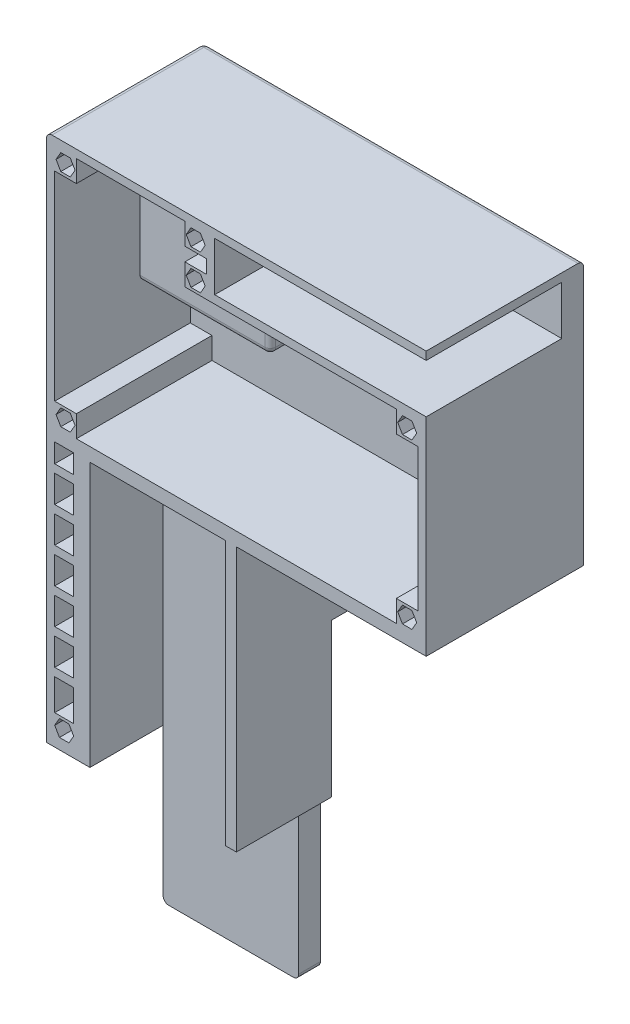
from build123d import *

# Parameters (mm, degrees)
EXTRUDE_1_DEPTH        = 8
SKETCH_7_W             = 53
SKETCH_7_H             = 154
EXTRUDE_4_DEPTH        = 8
SKETCH_8_W             = 3
SKETCH_8_H             = 56.5
CUT_EXTRUDE_7_DEPTH    = 184.508458055
SKETCH_11_W            = 75
SKETCH_11_H            = 3
EXTRUDE_7_DEPTH        = 50
SKETCH_13_W            = 3
SKETCH_13_H            = 94.5
EXTRUDE_8_DEPTH        = 40
SKETCH_14_W            = 3
SKETCH_14_H            = 97.5
EXTRUDE_13_DEPTH       = 17
EXTRUDE_14_DEPTH       = 50
SKETCH_18_W            = 6
SKETCH_18_H            = 94.5
EXTRUDE_15_DEPTH       = 35
SKETCH_3_W             = 57
SKETCH_3_H             = 23
CUT_EXTRUDE_10_DEPTH   = 56.5
SKETCH_19_W            = 8
SKETCH_19_H            = 8
EXTRUDE_19_DEPTH       = 43
SKETCH_25_W            = 10
SKETCH_25_H            = 3
EXTRUDE_20_DEPTH       = 15
SKETCH_26_W            = 8
SKETCH_26_H            = 8
SKETCH_26_W_2          = 7
EXTRUDE_21_DEPTH       = 7
SKETCH_28_W            = 47
SKETCH_28_H            = 47
CUT_EXTRUDE_11_DEPTH   = 10.5
SKETCH_29_W            = 44
SKETCH_29_H            = 47
EXTRUDE_22_DEPTH       = 16
SKETCH_30_R            = 1.5
CUT_EXTRUDE_13_DEPTH   = 15
EXTRUDE_START          = -18.5
EXTRUDE_23_DEPTH       = 18.5
FILLET_3_R             = 2
FILLET_4_R             = 2
FILLET_5_R             = 2
FILLET_7_R             = 2
FILLET_8_R             = 2
FILLET_9_R             = 2
SKETCH_32_W            = 7
SKETCH_32_H            = 3
EXTRUDE_24_DEPTH       = 50
PATTERN_LINEAR_1_COUNT = 6
PATTERN_LINEAR_1_PITCH = 13
FILLET_11_R            = 2
SKETCH_33_R            = 2.5
EXTRUDE_25_DEPTH       = 5
SKETCH_34_R            = 1.5
CUT_EXTRUDE_14_DEPTH   = 17
SKETCH_35_R            = 2.5
EXTRUDE_26_DEPTH       = 5


# Read off the part's stored shape, not the designer's step: 보스-돌출23
with BuildPart() as part:
    # 스케치1 → 보스-돌출1 (new body)
    with BuildSketch(Plane.XY):
        Polygon((114.748799453, 110.152671756), (44.748799453, 110.152671756), (-25.251200547, 110.152671756), (-25.251200547, 12.652671756), (44.748799453, 12.652671756), (44.748799453, -84.847328244), (114.748799453, -84.847328244), (114.748799453, 12.652671756), align=None)
    extrude(amount=EXTRUDE_1_DEPTH)

    # 스케치11 → 보스-돌출7 (add)
    with BuildSketch(Plane.XY.offset(8)):
        with Locations((15.248799453, 87.652671756)):
            Rectangle(SKETCH_11_W, SKETCH_11_H)
        Polygon((52.748799453, 107.152671756), (52.748799453, 89.152671756), (52.748799453, 86.152671756), (55.748799453, 86.152671756), (55.748799453, 107.152671756), align=None)
    extrude(amount=EXTRUDE_7_DEPTH)

    # 스케치13 → 보스-돌출8 (add)
    with BuildSketch(Plane.XY.offset(8)):
        with Locations((103.248799453, -34.597328244)):
            Rectangle(SKETCH_13_W, SKETCH_13_H)
    extrude(amount=EXTRUDE_8_DEPTH)

    # 스케치14 → 보스-돌출13 (add)
    with BuildSketch(Plane.XY.offset(31)):
        with Locations((100.248799453, -36.097328244)):
            Rectangle(SKETCH_14_W, SKETCH_14_H)
    extrude(amount=EXTRUDE_13_DEPTH)



with BuildPart() as body_2:
    # 스케치7 → 보스-돌출4 (new body)
    with BuildSketch(Plane(origin=(0, 0, 23), x_dir=(-1, 0, 0), z_dir=(0, 0, -1))):
        with Locations((-75.248799453, -64.347328244)):
            Rectangle(SKETCH_7_W, SKETCH_7_H)
    extrude(amount=-EXTRUDE_4_DEPTH)

    # 스케치8 → 컷-돌출7 (cut, through all)
    with BuildSketch(Plane(origin=(0, 0, 23), x_dir=(-1, 0, 0), z_dir=(0, 0, -1))):
        with Locations((-100.248799453, -113.097328244)):
            Rectangle(SKETCH_8_W, SKETCH_8_H)
    extrude(amount=-CUT_EXTRUDE_7_DEPTH, mode=Mode.SUBTRACT)


with BuildPart() as body_3:
    # 스케치15 → 보스-돌출14 (new body)
    with BuildSketch(Plane.XY.offset(8)):
        Polygon((-25.251200547, 17.652671756), (-25.251200547, 12.652671756), (44.748799453, 12.652671756), (44.748799453, -84.847328244), (48.748799453, -84.847328244), (48.748799453, 12.652671756), (101.748799453, 12.652671756), (104.748799453, 12.652671756), (111.748799453, 12.652671756), (111.748799453, -84.847328244), (114.748799453, -84.847328244), (114.748799453, 12.652671756), (114.748799453, 17.652671756), (114.748799453, 110.152671756), (111.748799453, 110.152671756), (-25.251200547, 110.152671756), (-25.251200547, 107.152671756), (52.748799453, 107.152671756), (52.825864214, 107.152671756), (55.748799453, 107.152671756), (111.748799453, 107.152671756), (111.748799453, 17.652671756), (-22.251200547, 17.652671756), (-22.251200547, 86.152671756), (-22.251200547, 89.152671756), (-25.251200547, 89.152671756), align=None)
    extrude(amount=EXTRUDE_14_DEPTH)


with BuildPart() as part_1:
    add(part.part)

    add(body_3.part)  # 보스-돌출15 merges body 3
    # 스케치18 → 보스-돌출15 (add)
    with BuildSketch(Plane(origin=(0, 0, 23), x_dir=(-1, 0, 0), z_dir=(0, 0, -1))):
        with Locations((-101.748799453, -34.597328244)):
            Rectangle(SKETCH_18_W, SKETCH_18_H)
        Polygon((-98.748799453, -84.847328244), (-98.748799453, -81.847328244), (-104.748799453, -81.847328244), (-111.748799453, -81.847328244), (-111.748799453, -84.847328244), align=None)
    extrude(amount=-EXTRUDE_15_DEPTH)

    # 스케치3 → 컷-돌출10 (cut)
    with BuildSketch(Plane.XZ.offset(84.847328244)):
        with Locations((73.248799453, 11.5)):
            Rectangle(SKETCH_3_W, SKETCH_3_H)
    extrude(amount=-CUT_EXTRUDE_10_DEPTH, mode=Mode.SUBTRACT)

    # 스케치19 → 보스-돌출19 (add)
    # profile 1 of 7: a face of its own
    with BuildSketch(Plane.XY.offset(15)):
        with Locations((59.748799453, 103.152671756)):
            Rectangle(SKETCH_19_W, SKETCH_19_H)
        Polygon((56.248799453, 103.153760669), (57.998799453, 100.122671756), (61.498799453, 100.122671756), (63.248799453, 103.153760669), (61.498799453, 106.184849582), (57.998799453, 106.184849582), align=None, mode=Mode.SUBTRACT)
    # profile 2 of 7: a face of its own
    with BuildSketch(Plane.XY.offset(15)):
        with Locations((107.748799453, 103.152671756)):
            Rectangle(SKETCH_19_W, SKETCH_19_H)
        Polygon((104.248799453, 103.153760669), (105.998799453, 100.122671756), (109.498799453, 100.122671756), (111.248799453, 103.153760669), (109.498799453, 106.184849582), (105.998799453, 106.184849582), align=None, mode=Mode.SUBTRACT)
    # profile 3 of 7: a face of its own
    with BuildSketch(Plane.XY.offset(15)):
        with Locations((-18.251200547, 21.652671756)):
            Rectangle(SKETCH_19_W, SKETCH_19_H)
        Polygon((-21.751200547, 21.653760669), (-20.001200547, 18.622671756), (-16.501200547, 18.622671756), (-14.751200547, 21.653760669), (-16.501200547, 24.684849582), (-20.001200547, 24.684849582), align=None, mode=Mode.SUBTRACT)
    # profile 4 of 7: a face of its own
    with BuildSketch(Plane.XY.offset(15)):
        with Locations((-18.251200547, 82.152671756)):
            Rectangle(SKETCH_19_W, SKETCH_19_H)
        Polygon((-21.751200547, 82.153760669), (-20.001200547, 79.122671756), (-16.501200547, 79.122671756), (-14.751200547, 82.153760669), (-16.501200547, 85.184849582), (-20.001200547, 85.184849582), align=None, mode=Mode.SUBTRACT)
    # profile 5 of 7: a face of its own
    with BuildSketch(Plane.XY.offset(15)):
        with Locations((108.248799453, -77.847328244)):
            Rectangle(SKETCH_19_W, SKETCH_19_H)
        Polygon((104.748799453, -77.846239331), (106.498799453, -80.877328244), (109.998799453, -80.877328244), (111.748799453, -77.846239331), (109.998799453, -74.815150418), (106.498799453, -74.815150418), align=None, mode=Mode.SUBTRACT)
    # profile 6 of 7: a face of its own
    with BuildSketch(Plane.XY.offset(15)):
        with Locations((107.748799453, 21.652671756)):
            Rectangle(SKETCH_19_W, SKETCH_19_H)
        Polygon((104.248799453, 21.653760669), (105.998799453, 18.622671756), (109.498799453, 18.622671756), (111.248799453, 21.653760669), (109.498799453, 24.684849582), (105.998799453, 24.684849582), align=None, mode=Mode.SUBTRACT)
    # profile 7 of 7: a face of its own
    with BuildSketch(Plane.XY.offset(15)):
        with Locations((59.748799453, 90.152671756)):
            Rectangle(SKETCH_19_W, SKETCH_19_H)
        Polygon((56.248799453, 90.153760669), (57.998799453, 87.122671756), (61.498799453, 87.122671756), (63.248799453, 90.153760669), (61.498799453, 93.184849582), (57.998799453, 93.184849582), align=None, mode=Mode.SUBTRACT)
    extrude(amount=EXTRUDE_19_DEPTH)


    add(body_2.part)  # 보스-돌출20 merges body 2
    # 스케치25 → 보스-돌출20 (add)
    with BuildSketch(Plane.XY.offset(8)):
        with Locations((106.748799453, -83.347328244)):
            Rectangle(SKETCH_25_W, SKETCH_25_H)
    extrude(amount=EXTRUDE_20_DEPTH)

    # 스케치26 → 보스-돌출21 (add)
    with BuildSketch(Plane.XY.offset(8)):
        with Locations((59.748799453, 103.152671756)):
            Rectangle(SKETCH_26_W, SKETCH_26_H)
        with Locations((59.748799453, 90.152671756)):
            Rectangle(SKETCH_26_W, SKETCH_26_H)
        with Locations((107.748799453, 103.152671756)):
            Rectangle(SKETCH_26_W, SKETCH_26_H)
        with Locations((107.748799453, 21.652671756)):
            Rectangle(SKETCH_26_W, SKETCH_26_H)
        with Locations((-18.251200547, 21.652671756)):
            Rectangle(SKETCH_26_W, SKETCH_26_H)
        with Locations((-18.251200547, 82.152671756)):
            Rectangle(SKETCH_26_W, SKETCH_26_H)
        with Locations((108.248799453, -77.847328244)):
            Rectangle(SKETCH_26_W_2, SKETCH_26_H)
    extrude(amount=EXTRUDE_21_DEPTH)

    # 스케치28 → 컷-돌출11 (cut)
    with BuildSketch(Plane(origin=(0, 0, 0), x_dir=(-1, 0, 0), z_dir=(0, 0, -1))):
        with Locations((-91.248799453, 75.652671756)):
            Rectangle(SKETCH_28_W, SKETCH_28_H)
    extrude(amount=-CUT_EXTRUDE_11_DEPTH, mode=Mode.SUBTRACT)

    # 스케치29 → 보스-돌출22 (add)
    with BuildSketch(Plane(origin=(0, 0, 10.5), x_dir=(-1, 0, 0), z_dir=(0, 0, -1))):
        with Locations((-89.748799453, 75.652671756)):
            Rectangle(SKETCH_29_W, SKETCH_29_H)
    extrude(amount=-EXTRUDE_22_DEPTH)

    # 스케치30 → 컷-돌출13 (cut)
    with BuildSketch(Plane(origin=(0, 0, 10.5), x_dir=(-1, 0, 0), z_dir=(0, 0, -1))):
        with Locations((-101.998799453, 90.402671756)):
            Circle(SKETCH_30_R)
        with Locations((-80.498799453, 90.402671756)):
            Circle(SKETCH_30_R)
        with Locations((-101.998799453, 60.902671756)):
            Circle(SKETCH_30_R)
        with Locations((-80.498799453, 60.902671756)):
            Circle(SKETCH_30_R)
    extrude(amount=-CUT_EXTRUDE_13_DEPTH, mode=Mode.SUBTRACT)

    # 보스-돌출23 outline → 보스-돌출23 (add)
    with BuildSketch(Plane.XY.offset(26.5).offset(EXTRUDE_START)):
        Polygon((63.748799453, 48.152671756), (111.748799453, 48.152671756), (111.748799453, 99.152671756), (103.748799453, 99.152671756), (103.748799453, 107.152671756), (63.748799453, 107.152671756), (63.748799453, 99.152671756), (55.748799453, 99.152671756), (55.748799453, 94.152671756), (63.748799453, 94.152671756), align=None)
    extrude(amount=EXTRUDE_23_DEPTH)

    # 필렛3
    fillet_3_edges = [part_1.edges().sort_by_distance(p)[0] for p in [
        (114.748799453, 110.152671756, 29),
    ]]
    fillet(fillet_3_edges, radius=FILLET_3_R)

    # 필렛4
    fillet_4_edges = [part_1.edges().sort_by_distance(p)[0] for p in [
        (114.748799453, -16.347328244, 0),
    ]]
    fillet(fillet_4_edges, radius=FILLET_4_R)

    # 필렛5
    fillet_5_edges = [part_1.edges().sort_by_distance(p)[0] for p in [
        (43.748799453, 110.152671756, 0),
        (114.748799453, 103.652671756, 0),
        (114.163013015, 109.566885318, 0),
    ]]
    fillet(fillet_5_edges, radius=FILLET_5_R)

    # 필렛7
    fillet_7_edges = [part_1.edges().sort_by_distance(p)[0] for p in [
        (114.748799453, 75.652671756, 10.5),
        (67.748799453, 75.652671756, 0),
    ]]
    fillet(fillet_7_edges, radius=FILLET_7_R)

    # 필렛8
    fillet_8_edges = [part_1.edges().sort_by_distance(p)[0] for p in [
        (114.748799453, 99.152671756, 7.25),
        (114.163013015, 99.152671756, 0.585786438),
        (114.748799453, 52.152671756, 7.25),
        (114.163013015, 52.152671756, 0.585786438),
        (89.248799453, 99.152671756, 0),
        (89.248799453, 52.152671756, 0),
    ]]
    fillet(fillet_8_edges, radius=FILLET_8_R - 0.0001)  # a hair under: the kernel refuses the full size

    # 필렛9
    fillet_9_edges = [part_1.edges().sort_by_distance(p)[0] for p in [
        (98.748799453, -141.347328244, 27),
        (48.748799453, -141.347328244, 27),
    ]]
    fillet(fillet_9_edges, radius=FILLET_9_R)

    # 스케치32 → 보스-돌출24 (add)
    with BuildSketch(Plane.XY.offset(8)):
        with Locations((108.248799453, 4.152671756)):
            Rectangle(SKETCH_32_W, SKETCH_32_H)
    extrude_24 = extrude(amount=EXTRUDE_24_DEPTH)

    # 선형 패턴1: 보스-돌출24 ×6
    with Locations(*[(0, -i * PATTERN_LINEAR_1_PITCH, 0) for i in range(1, PATTERN_LINEAR_1_COUNT)]):
        add(extrude_24)

    # 필렛11
    fillet_11_edges = [part_1.edges().sort_by_distance(p)[0] for p in [
        (63.748799453, 48.152671756, 17.25),
        (87.748799453, 48.152671756, 26.5),
        (63.748799453, 67.152671756, 26.5),
    ]]
    fillet(fillet_11_edges, radius=FILLET_11_R)

    # 스케치33 → 보스-돌출25 (add)
    with BuildSketch(Plane(origin=(0, 0, 23), x_dir=(-1, 0, 0), z_dir=(0, 0, -1))):
        with Locations(Location((-73.748799453, -33.647328244, 0), (0, 0, 180))):
            Circle(SKETCH_33_R)
        with Locations(Location((-73.748799453, -120.647328244, 0), (0, 0, 180))):
            Circle(SKETCH_33_R)
        with BuildLine():
            Line((-71.748799453, -7.147328244), (-71.748799453, -13.147328244))
            ThreePointArc((-71.748799453, -13.147328244), (-73.748799453, -15.147328244), (-75.748799453, -13.147328244))
            Line((-75.748799453, -13.147328244), (-75.748799453, -7.147328244))
            ThreePointArc((-75.748799453, -7.147328244), (-73.748799453, -5.147328244), (-71.748799453, -7.147328244))
        make_face()
        with BuildLine():
            Line((-70.748799453, -26.147328244), (-76.748799453, -26.147328244))
            ThreePointArc((-76.748799453, -26.147328244), (-78.748799453, -24.147328244), (-76.748799453, -22.147328244))
            Line((-76.748799453, -22.147328244), (-70.748799453, -22.147328244))
            ThreePointArc((-70.748799453, -22.147328244), (-68.748799453, -24.147328244), (-70.748799453, -26.147328244))
        make_face()
    extrude(amount=EXTRUDE_25_DEPTH)

    # 스케치34 → 컷-돌출14 (cut)
    with BuildSketch(Plane(origin=(0, 0, 8), x_dir=(-1, 0, 0), z_dir=(0, 0, -1))):
        with Locations((-100.998799453, 90.902671756)):
            Circle(SKETCH_34_R)
        with Locations((-79.498799453, 90.902671756)):
            Circle(SKETCH_34_R)
        with Locations((-79.498799453, 60.402671756)):
            Circle(SKETCH_34_R)
        with Locations((-100.998799453, 60.402671756)):
            Circle(SKETCH_34_R)
    extrude(amount=-CUT_EXTRUDE_14_DEPTH, mode=Mode.SUBTRACT)


with BuildPart() as body_2_2:
    # 대칭 복사3: mirrored copy
    add(part_1.part.mirror(Plane.ZY.offset(40.251200547)))

    # 스케치35 → 보스-돌출26 (add)
    with BuildSketch(Plane(origin=(0, 89.152671756, 0), x_dir=(1, 0, 0), z_dir=(0, 1, 0))):
        with Locations(Location((-88.251200547, -33, 0), (0, 0, 180))):
            Circle(SKETCH_35_R)
        with BuildLine():
            Line((-114.751200547, -30.5), (-108.751200547, -30.5))
            ThreePointArc((-108.751200547, -30.5), (-106.251200547, -33), (-108.751200547, -35.5))
            Line((-108.751200547, -35.5), (-114.751200547, -35.5))
            ThreePointArc((-114.751200547, -35.5), (-117.251200547, -33), (-114.751200547, -30.5))
        make_face()
        with BuildLine():
            Line((-100.251200547, -36), (-100.251200547, -30))
            ThreePointArc((-100.251200547, -30), (-97.751200547, -27.5), (-95.251200547, -30))
            Line((-95.251200547, -30), (-95.251200547, -36))
            ThreePointArc((-95.251200547, -36), (-97.751200547, -38.5), (-100.251200547, -36))
        make_face()
    extrude(amount=EXTRUDE_26_DEPTH)


solid = body_2_2.part
